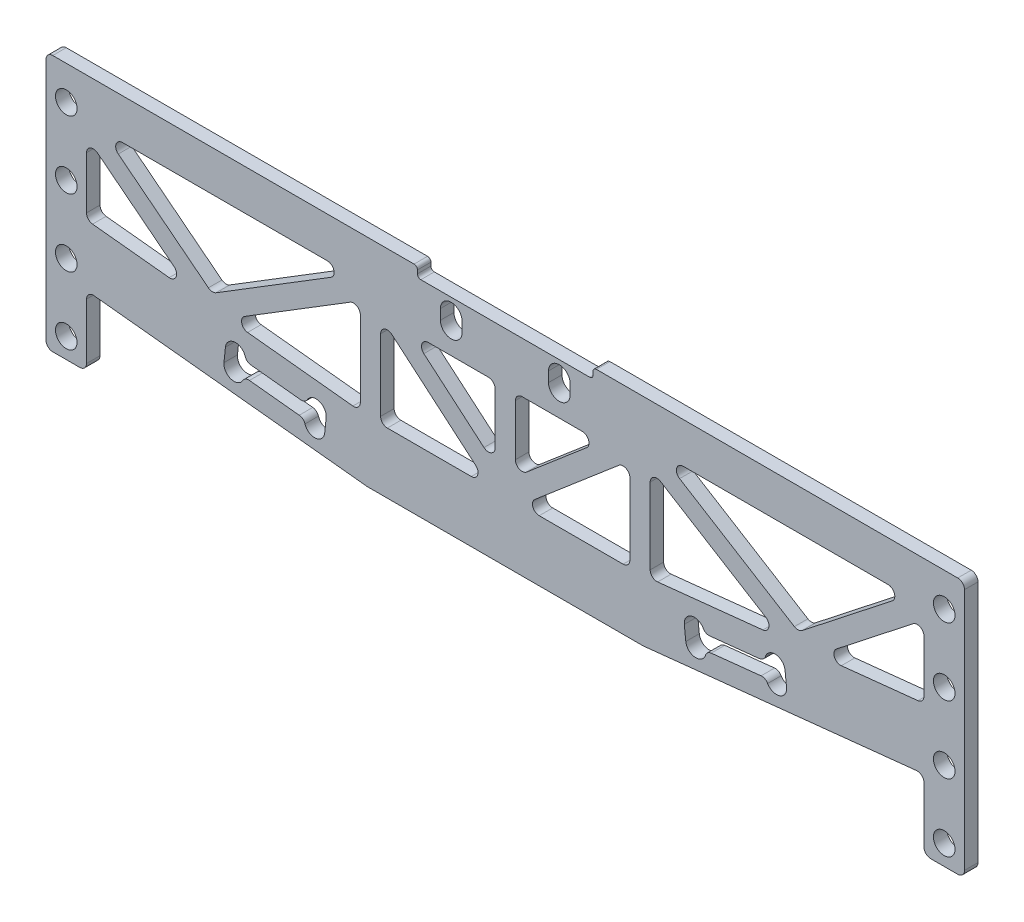
from build123d import *

# Parameters (mm, degrees)
SKETCH_1_W           = 136
SKETCH_1_H           = 40
EXTRUDE_1_DEPTH      = 2
SKETCH_3_R           = 1.6
CUT_EXTRUDE_3_DEPTH  = 71.908391605
CUT_EXTRUDE_5_DEPTH  = 71.908391605
SKETCH_7_W           = 136
SKETCH_7_H           = 8
CUT_EXTRUDE_6_DEPTH  = 71.908391605
CUT_EXTRUDE_7_DEPTH  = 71.908391605
CUT_EXTRUDE_START    = -2
CUT_EXTRUDE_8_DEPTH  = 2
FILLET_2_R           = 1
FILLET_3_R           = 1
SKETCH_11_W          = 26
SKETCH_11_H          = 3
CUT_EXTRUDE_9_DEPTH  = 71.908391605
FILLET_4_R           = 0.5
SKETCH_13_W          = 6
SKETCH_13_H          = 28
SKETCH_13_R          = 1.6
EXTRUDE_2_DEPTH      = 2
SKETCH_14_R          = 1.6
CUT_EXTRUDE_10_DEPTH = 10
FILLET_5_R           = 1
FILLET_6_R           = 1


# Read off the part's stored shape, not the designer's step: 切除-拉伸8
with BuildPart() as part:
    # 草图1 → 凸台-拉伸1 (new body)
    with BuildSketch(Plane.XY):
        Rectangle(SKETCH_1_W, SKETCH_1_H)
    extrude(amount=EXTRUDE_1_DEPTH)

    # 草图3 → 切除-拉伸3 (cut, through all)
    with BuildSketch(Plane.XY.offset(2)):
        with Locations((65, -5)):
            Circle(SKETCH_3_R)
        with Locations((65, 15)):
            Circle(SKETCH_3_R)
        with Locations((-65, 15)):
            Circle(SKETCH_3_R)
        with Locations((-65, -5)):
            Circle(SKETCH_3_R)
    extrude(amount=-CUT_EXTRUDE_3_DEPTH, mode=Mode.SUBTRACT)

    # 草图6 → 切除-拉伸5 (cut, through all)
    with BuildSketch(Plane.XY.offset(2)):
        with BuildLine():
            Line((26.513057993, -6.191225838), (29.496623679, -5.877640448))
            ThreePointArc((29.496623679, -5.877640448), (27.848048141, -4.5426503), (26.513057993, -6.191225838))
        make_face()
        Polygon((29.716133451, -7.966136428), (29.496623679, -5.877640448), (26.513057993, -6.191225838), (26.732567765, -8.279721818), align=None)
        with BuildLine():
            ThreePointArc((26.732567765, -8.279721818), (28.381143303, -9.614711966), (29.716133451, -7.966136428))
            Line((29.716133451, -7.966136428), (26.732567765, -8.279721818))
        make_face()
        Polygon((38.66683051, -7.025380259), (38.447320737, -4.936884279), (29.496623679, -5.877640448), (29.716133451, -7.966136428), align=None)
        Polygon((41.650396196, -6.711794869), (41.430886423, -4.623298889), (38.447320737, -4.936884279), (38.66683051, -7.025380259), align=None)
        with BuildLine():
            Line((38.447320737, -4.936884279), (41.430886423, -4.623298889))
            ThreePointArc((41.430886423, -4.623298889), (39.782310885, -3.288308741), (38.447320737, -4.936884279))
        make_face()
        with BuildLine():
            ThreePointArc((38.66683051, -7.025380259), (40.315406048, -8.360370407), (41.650396196, -6.711794869))
            Line((41.650396196, -6.711794869), (38.66683051, -7.025380259))
        make_face()
    cut_extrude_5 = extrude(amount=-CUT_EXTRUDE_5_DEPTH, mode=Mode.SUBTRACT)

    # 镜向1: 切除-拉伸5 across plane
    add(cut_extrude_5.mirror(Plane(origin=(0, 0, 0), x_dir=(0, 0, 1), z_dir=(1, 0, 0))), mode=Mode.SUBTRACT)

    # 草图7 → 切除-拉伸6 (cut, through all)
    with BuildSketch(Plane.XY.offset(2)):
        with Locations((0, -16)):
            Rectangle(SKETCH_7_W, SKETCH_7_H)
    extrude(amount=-CUT_EXTRUDE_6_DEPTH, mode=Mode.SUBTRACT)

    # 草图8 → 切除-拉伸7 (cut, through all)
    with BuildSketch(Plane.XY.offset(2)):
        Polygon((-68, -7), (-68, -12), (-20.428177729, -12), align=None)
        Polygon((20.428177729, -12), (68, -7), (68, -12), align=None)
    extrude(amount=-CUT_EXTRUDE_7_DEPTH, mode=Mode.SUBTRACT)

    # 切除-拉伸8 outline → 切除-拉伸8 (cut)
    with BuildSketch(Plane.XY.offset(2).offset(CUT_EXTRUDE_START)):
        Polygon((18.456507715, 10.75175987), (2.313148778, -3), (18.456507715, -3), align=None)
        Polygon((-18.456507715, 10.75175987), (-18.456507715, -3), (-2.313148778, -3), align=None)
        Polygon((-62, 12.092619933), (-62, 1.418949104), (-46.311418135, -0.229987295), align=None)
        Polygon((-21.456507715, 11.312594625), (-41.066399544, -0.781260963), (-21.456507715, -2.842343647), align=None)
        Polygon((-59.571610636, 14), (-43.404423487, 1.301471928), (-22.814069976, 14), align=None)
        Polygon((43.404423487, 1.301471928), (59.571610636, 14), (22.814069976, 14), align=None)
        Polygon((-14.121622282, 11), (-1.5, 0.24824013), (-1.5, 11), align=None)
        Polygon((1.5, 0.24824013), (14.121622282, 11), (1.5, 11), align=None)
        Polygon((41.066399544, -0.781260963), (21.456507715, 11.312594625), (21.456507715, -2.842343647), align=None)
        Polygon((62, 12.092619933), (46.311418135, -0.229987295), (62, 1.418949104), align=None)
    extrude(amount=CUT_EXTRUDE_8_DEPTH, mode=Mode.SUBTRACT)

    # 圆角2
    fillet_2_edges = [part.edges().sort_by_distance(p)[0] for p in [
        (-68, -7, 1),
        (-20.428177729, -12, 1),
        (20.428177729, -12, 1),
        (68, -7, 1),
        (-68, 20, 1),
        (68, 20, 1),
    ]]
    fillet(fillet_2_edges, radius=FILLET_2_R)

    # 圆角3
    fillet_3_edges = [part.edges().sort_by_distance(p)[0] for p in [
        (14.121622282, 11, 1),
        (1.5, 0.24824013, 1),
        (1.5, 11, 1),
        (46.311418135, -0.229987295, 1),
        (62, 12.092619933, 1),
        (62, 1.418949104, 1),
        (21.456507715, 11.312594625, 1),
        (41.066399544, -0.781260963, 1),
        (21.456507715, -2.842343647, 1),
        (43.404423487, 1.301471928, 1),
        (22.814069976, 14, 1),
        (59.571610636, 14, 1),
        (-18.456507715, -3, 1),
        (-18.456507715, 10.75175987, 1),
        (-2.313148778, -3, 1),
        (-1.5, 11, 1),
        (-1.5, 0.24824013, 1),
        (-14.121622282, 11, 1),
        (-43.404423487, 1.301471928, 1),
        (-59.571610636, 14, 1),
        (-22.814069976, 14, 1),
        (-21.456507715, -2.842343647, 1),
        (-41.066399544, -0.781260963, 1),
        (-21.456507715, 11.312594625, 1),
        (-46.311418135, -0.229987295, 1),
        (-62, 1.418949104, 1),
        (-62, 12.092619933, 1),
        (18.456507715, -3, 1),
        (2.313148778, -3, 1),
        (18.456507715, 10.75175987, 1),
        (29.496623679, -5.877640448, 1),
        (38.447320737, -4.936884279, 1),
        (38.66683051, -7.025380259, 1),
        (29.716133451, -7.966136428, 1),
        (-29.496623679, -5.877640448, 1),
        (-29.716133451, -7.966136428, 1),
        (-38.66683051, -7.025380259, 1),
        (-38.447320737, -4.936884279, 1),
    ]]
    fillet(fillet_3_edges, radius=FILLET_3_R)

    # 草图11 → 切除-拉伸9 (cut, through all)
    with BuildSketch(Plane(origin=(0, 0, 0), x_dir=(-1, 0, 0), z_dir=(0, 0, -1))):
        with BuildLine():
            Line((-6.4, 16.25), (-6.4, 14.75))
            ThreePointArc((-6.4, 14.75), (-8, 13.15), (-9.6, 14.75))
            Line((-9.6, 14.75), (-9.6, 16.25))
            ThreePointArc((-9.6, 16.25), (-8, 17.85), (-6.4, 16.25))
        make_face()
        with BuildLine():
            Line((9.6, 16.25), (9.6, 14.75))
            ThreePointArc((9.6, 14.75), (8, 13.15), (6.4, 14.75))
            Line((6.4, 14.75), (6.4, 16.25))
            ThreePointArc((6.4, 16.25), (8, 17.85), (9.6, 16.25))
        make_face()
        with Locations((0, 20)):
            Rectangle(SKETCH_11_W, SKETCH_11_H)
    extrude(amount=-CUT_EXTRUDE_9_DEPTH, mode=Mode.SUBTRACT)

    # 圆角4
    fillet_4_edges = [part.edges().sort_by_distance(p)[0] for p in [
        (13, 20, 1),
        (-13, 20, 1),
        (13, 18.5, 1),
        (-13, 18.5, 1),
    ]]
    fillet(fillet_4_edges, radius=FILLET_4_R)

    # 草图13 → 凸台-拉伸2 (add)
    # profile 1 of 2: a face of its own
    with BuildSketch(Plane(origin=(0, 0, 0), x_dir=(-1, 0, 0), z_dir=(0, 0, -1))):
        with Locations((-65, -4)):
            Rectangle(SKETCH_13_W, SKETCH_13_H)
        with Locations((-65, -15)):
            Circle(SKETCH_13_R, mode=Mode.SUBTRACT)
    # profile 2 of 2: a face of its own
    with BuildSketch(Plane(origin=(0, 0, 0), x_dir=(-1, 0, 0), z_dir=(0, 0, -1))):
        with Locations((65, -4)):
            Rectangle(SKETCH_13_W, SKETCH_13_H)
        with Locations((65, -15)):
            Circle(SKETCH_13_R, mode=Mode.SUBTRACT)
    extrude(amount=-EXTRUDE_2_DEPTH)

    # 草图14 → 切除-拉伸10 (cut)
    with BuildSketch(Plane(origin=(0, 0, 0), x_dir=(-1, 0, 0), z_dir=(0, 0, -1))):
        with Locations((-65, 5)):
            Circle(SKETCH_14_R)
        with Locations((-65, -5)):
            Circle(SKETCH_14_R)
    cut_extrude_10 = extrude(amount=-CUT_EXTRUDE_10_DEPTH, mode=Mode.SUBTRACT)

    # 圆角5
    fillet_5_edges = [part.edges().sort_by_distance(p)[0] for p in [
        (68, -18, 1),
        (62, -7.630625412, 1),
        (62, -18, 1),
    ]]
    fillet(fillet_5_edges, radius=FILLET_5_R)

    # 镜向4: 切除-拉伸10 across plane
    add(cut_extrude_10.mirror(Plane(origin=(0, 0, 0), x_dir=(0, 0, 1), z_dir=(1, 0, 0))), mode=Mode.SUBTRACT)

    # 圆角6
    fillet_6_edges = [part.edges().sort_by_distance(p)[0] for p in [
        (-62, -18, 1),
        (-62, -7.630625412, 1),
        (-68, -18, 1),
    ]]
    fillet(fillet_6_edges, radius=FILLET_6_R)


solid = part.part
